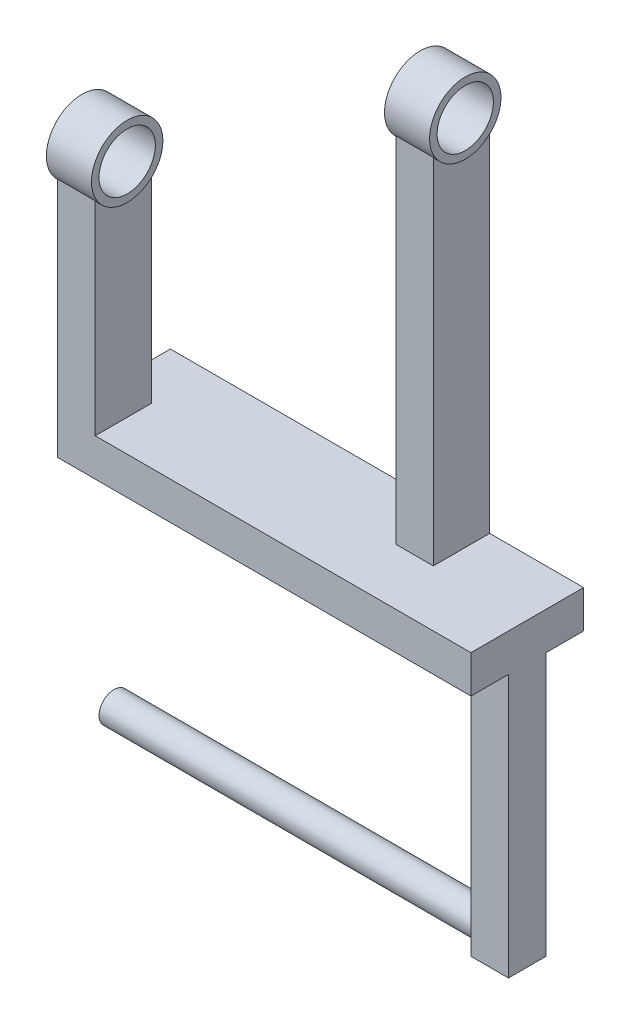
from build123d import *

# Parameters (mm, degrees)
SKETCH2_W            = 110
SKETCH2_H            = 30
BOSS_EXTRUDE2_DEPTH  = 10
SKETCH15_W           = 10
SKETCH15_H           = 15
BOSS_EXTRUDE9_DEPTH  = 60
SKETCH17_R           = 9.5
SKETCH17_R_2         = 7.5
EXTRUDE_THIN3_DEPTH  = 6
CUT_EXTRUDE4_START   = -5
CUT_EXTRUDE4_DEPTH   = 10
SKETCH19_W           = 10
SKETCH19_H           = 15
BOSS_EXTRUDE11_DEPTH = 100
SKETCH20_R           = 9.5
SKETCH20_R_2         = 7.5
EXTRUDE_THIN4_DEPTH  = 6
CUT_EXTRUDE5_START   = -5
CUT_EXTRUDE5_DEPTH   = 10
SKETCH21_W           = 10
SKETCH21_H           = 10
BOSS_EXTRUDE12_DEPTH = 70
SKETCH22_R           = 4
BOSS_EXTRUDE13_DEPTH = 100


# Read off the part's stored shape, not the designer's step: Cut-Extrude4, Cut-Extrude5
with BuildPart() as part:
    # Sketch2 → Boss-Extrude2 (new body)
    with BuildSketch(Plane(origin=(0, 0, 0), x_dir=(1, 0, 0), z_dir=(0, 1, 0))):
        with Locations((-5, 0)):
            Rectangle(SKETCH2_W, SKETCH2_H)
    extrude(amount=BOSS_EXTRUDE2_DEPTH)

    # Sketch15 → Boss-Extrude9 (add)
    with BuildSketch(Plane(origin=(0, 10, 0), x_dir=(1, 0, 0), z_dir=(0, 1, 0))):
        with Locations((-55, -7.5)):
            Rectangle(SKETCH15_W, SKETCH15_H)
    extrude(amount=BOSS_EXTRUDE9_DEPTH)

    # Sketch17 → Extrude-Thin3 (add, symmetric)
    with BuildSketch(Plane.ZY.offset(55)):
        with Locations((7.5, 70)):
            Circle(SKETCH17_R)
        with Locations((7.5, 70)):
            Circle(SKETCH17_R_2, mode=Mode.SUBTRACT)
    extrude(amount=EXTRUDE_THIN3_DEPTH, both=True)

    # Cut-Extrude4 outline → Cut-Extrude4 (cut)
    with BuildSketch(Plane.ZY.offset(55).offset(CUT_EXTRUDE4_START)):
        with BuildLine():
            ThreePointArc((0, 70), (7.5, 62.5), (15, 70))
            Line((15, 70), (0, 70))
        make_face()
    extrude(amount=CUT_EXTRUDE4_DEPTH, mode=Mode.SUBTRACT)

    # Sketch19 → Boss-Extrude11 (add)
    with BuildSketch(Plane(origin=(0, 10, 0), x_dir=(1, 0, 0), z_dir=(0, 1, 0))):
        with Locations((20, 7.5)):
            Rectangle(SKETCH19_W, SKETCH19_H)
    extrude(amount=BOSS_EXTRUDE11_DEPTH)

    # Sketch20 → Extrude-Thin4 (add, symmetric)
    with BuildSketch(Plane.ZY.offset(-20)):
        with Locations((-7.5, 110)):
            Circle(SKETCH20_R)
        with Locations((-7.5, 110)):
            Circle(SKETCH20_R_2, mode=Mode.SUBTRACT)
    extrude(amount=EXTRUDE_THIN4_DEPTH, both=True)

    # Cut-Extrude5 outline → Cut-Extrude5 (cut)
    with BuildSketch(Plane.ZY.offset(-20).offset(CUT_EXTRUDE5_START)):
        with BuildLine():
            ThreePointArc((-15, 110), (-7.5, 102.5), (0, 110))
            Line((0, 110), (-15, 110))
        make_face()
    extrude(amount=CUT_EXTRUDE5_DEPTH, mode=Mode.SUBTRACT)

    # Sketch21 → Boss-Extrude12 (add)
    with BuildSketch(Plane.XZ):
        with Locations((45, 0)):
            Rectangle(SKETCH21_W, SKETCH21_H)
    extrude(amount=BOSS_EXTRUDE12_DEPTH)

    # Sketch22 → Boss-Extrude13 (add)
    with BuildSketch(Plane.ZY.offset(-40)):
        with Locations(Location((0, -65, 0), (0, 0, 180))):
            Circle(SKETCH22_R)
    extrude(amount=BOSS_EXTRUDE13_DEPTH)


solid = part.part
